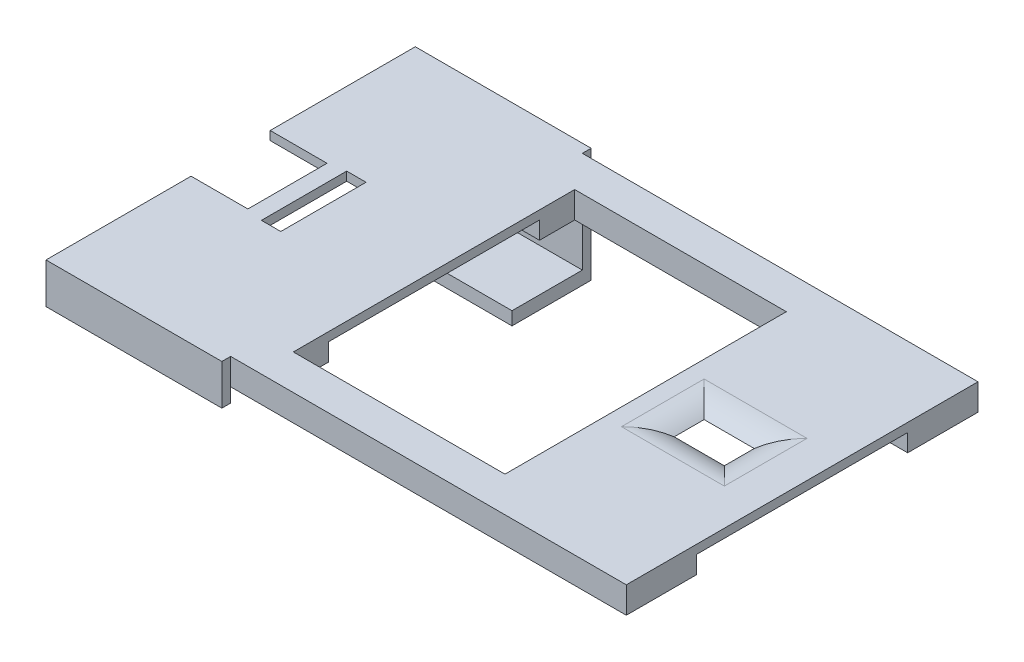
from build123d import *

# Parameters (mm, degrees)
SKETCH1_W               = 2.2
SKETCH1_H               = 9.7
SKETCH1_W_2             = 5.7
SKETCH1_H_2             = 3.4
BOSS_EXTRUDE2_DEPTH     = 3
CUT_EXTRUDE2_DEPTH      = 58.983591645
CUT_EXTRUDE2_DEPTH_BACK = 58.983591645
FILLET1_R               = 5
SKETCH4_W               = 20
SKETCH4_H               = 3
BOSS_EXTRUDE3_DEPTH     = 1
SKETCH5_W               = 20
SKETCH5_H               = 1
BOSS_EXTRUDE4_DEPTH     = 10
SKETCH6_W               = 20
SKETCH6_H               = 1.5
BOSS_EXTRUDE5_DEPTH     = 8
SKETCH7_W               = 20
SKETCH7_H               = 3
BOSS_EXTRUDE6_DEPTH     = 1
SKETCH8_W               = 20
SKETCH8_H               = 1
BOSS_EXTRUDE7_DEPTH     = 1.6


with BuildPart() as part:
    # Sketch1 → Boss-Extrude2 (new body)
    with BuildSketch(Plane(origin=(0, 0, 0), x_dir=(1, 0, 0), z_dir=(0, 1, 0))):
        Polygon((0, 15.5), (0, 0), (65, 0), (65, 40), (0, 40), (0, 24.5), (6.46, 24.5), (6.46, 15.5), align=None)
        with Locations((9.45, 20)):
            Rectangle(SKETCH1_W, SKETCH1_H, mode=Mode.SUBTRACT)
        with Locations((55, 20)):
            Rectangle(SKETCH1_W_2, SKETCH1_H_2, mode=Mode.SUBTRACT)
        Polygon((23.13, 11), (23.13, 29), (23.13, 36), (47.2, 36), (47.2, 29), (47.2, 11), (47.2, 4), (23.13, 4), align=None, mode=Mode.SUBTRACT)
    extrude(amount=BOSS_EXTRUDE2_DEPTH)

    # Sketch3 → Cut-Extrude2 (cut, two sides: drawn at the far end of the back side and taken through both)
    with BuildSketch(Plane(origin=(23.13, 0, 0), x_dir=(0, 0, -1), z_dir=(1, 0, 0)).offset(-CUT_EXTRUDE2_DEPTH_BACK)):
        Polygon((11, -0.008080614), (8, 0), (8, 2), (32, 2), (32, 0), align=None)
    extrude(amount=CUT_EXTRUDE2_DEPTH + CUT_EXTRUDE2_DEPTH_BACK, mode=Mode.SUBTRACT)

    # Fillet1
    # the kernel refuses this fillet: 5 mm, written as the material it takes off along each edge
    with BuildSketch(Plane(origin=(57.85, 3, -18.3), x_dir=(0, 0, 1), z_dir=(-1, 0, 0)), Plane(origin=(52.15, 3, -21.7), x_dir=(0, 0, -1), z_dir=(1, 0, 0))) as fillet1_piece_1:
        with BuildLine():
            CenterArc((3, -5), FILLET1_R, 90, 36.869897646)
            Line((0, -1), (0, 0))
            Line((0, 0), (3, 0))
        make_face()
    extrude(amount=5.7, mode=Mode.SUBTRACT)
    with BuildSketch(Plane(origin=(57.85, 3, -21.7), x_dir=(1, 0, 0), z_dir=(0, 0, 1)), Plane(origin=(52.15, 3, -18.3), x_dir=(-1, 0, 0), z_dir=(0, 0, -1))) as fillet1_piece_2:
        with BuildLine():
            CenterArc((3, -5), FILLET1_R, 90, 36.869897646)
            Line((0, -1), (0, 0))
            Line((0, 0), (3, 0))
        make_face()
    extrude(amount=3.4, mode=Mode.SUBTRACT)
    with BuildSketch(Plane(origin=(65.35, 3, -18.3), x_dir=(0, 0, 1), z_dir=(-1, 0, 0))) as fillet1_piece_3a_section:
        with BuildLine():
            CenterArc((3, -5), FILLET1_R, 90, 36.869897646)
            Line((0, -1), (0, 0))
            Line((0, 0), (3, 0))
        make_face()
    fillet1_piece_3a = extrude(amount=13.2, mode=Mode.PRIVATE)
    fillet1_piece_3a = split(fillet1_piece_3a, bisect_by=Plane(origin=(65, 3, -18.3), z_dir=(-1, 0, 0)), keep=Keep.TOP, mode=Mode.PRIVATE)
    fillet1_piece_3a = split(fillet1_piece_3a, bisect_by=Plane(origin=(57.85, 3, -18.3), z_dir=(1, 0, 0)), keep=Keep.TOP, mode=Mode.PRIVATE)
    with BuildSketch(Plane(origin=(57.85, 3, -21.7), x_dir=(1, 0, 0), z_dir=(0, 0, 1))) as fillet1_piece_3b_section:
        with BuildLine():
            CenterArc((3, -5), FILLET1_R, 90, 36.869897646)
            Line((0, -1), (0, 0))
            Line((0, 0), (3, 0))
        make_face()
    fillet1_piece_3b = extrude(amount=10.9, mode=Mode.PRIVATE)
    fillet1_piece_3b = split(fillet1_piece_3b, bisect_by=Plane(origin=(57.85, 3, -18.3), z_dir=(0, 0, 1)), keep=Keep.TOP, mode=Mode.PRIVATE)
    fillet1_piece_3 = fillet1_piece_3a & fillet1_piece_3b
    add(fillet1_piece_3, mode=Mode.SUBTRACT)
    with BuildSketch(Plane(origin=(57.85, 3, -18.3), x_dir=(0, 0, 1), z_dir=(-1, 0, 0))) as fillet1_piece_4a_section:
        with BuildLine():
            CenterArc((3, -5), FILLET1_R, 90, 36.869897646)
            Line((0, -1), (0, 0))
            Line((0, 0), (3, 0))
        make_face()
    fillet1_piece_4a = extrude(amount=13.2, mode=Mode.PRIVATE)
    fillet1_piece_4a = split(fillet1_piece_4a, bisect_by=Plane(origin=(47.2, 3, -18.3), z_dir=(1, 0, 0)), keep=Keep.TOP, mode=Mode.PRIVATE)
    fillet1_piece_4a = split(fillet1_piece_4a, bisect_by=Plane(origin=(52.15, 3, -18.3), z_dir=(-1, 0, 0)), keep=Keep.TOP, mode=Mode.PRIVATE)
    with BuildSketch(Plane(origin=(52.15, 3, -10.8), x_dir=(-1, 0, 0), z_dir=(0, 0, -1))) as fillet1_piece_4b_section:
        with BuildLine():
            CenterArc((3, -5), FILLET1_R, 90, 36.869897646)
            Line((0, -1), (0, 0))
            Line((0, 0), (3, 0))
        make_face()
    fillet1_piece_4b = extrude(amount=10.9, mode=Mode.PRIVATE)
    fillet1_piece_4b = split(fillet1_piece_4b, bisect_by=Plane(origin=(52.15, 3, -18.3), z_dir=(0, 0, 1)), keep=Keep.TOP, mode=Mode.PRIVATE)
    fillet1_piece_4 = fillet1_piece_4a & fillet1_piece_4b
    add(fillet1_piece_4, mode=Mode.SUBTRACT)
    with BuildSketch(Plane(origin=(52.15, 3, -21.7), x_dir=(0, 0, -1), z_dir=(1, 0, 0))) as fillet1_piece_5a_section:
        with BuildLine():
            CenterArc((3, -5), FILLET1_R, 90, 36.869897646)
            Line((0, -1), (0, 0))
            Line((0, 0), (3, 0))
        make_face()
    fillet1_piece_5a = extrude(amount=13.2, mode=Mode.PRIVATE)
    fillet1_piece_5a = split(fillet1_piece_5a, bisect_by=Plane(origin=(65, 3, -21.7), z_dir=(-1, 0, 0)), keep=Keep.TOP, mode=Mode.PRIVATE)
    fillet1_piece_5a = split(fillet1_piece_5a, bisect_by=Plane(origin=(57.85, 3, -21.7), z_dir=(1, 0, 0)), keep=Keep.TOP, mode=Mode.PRIVATE)
    with BuildSketch(Plane(origin=(57.85, 3, -29.2), x_dir=(1, 0, 0), z_dir=(0, 0, 1))) as fillet1_piece_5b_section:
        with BuildLine():
            CenterArc((3, -5), FILLET1_R, 90, 36.869897646)
            Line((0, -1), (0, 0))
            Line((0, 0), (3, 0))
        make_face()
    fillet1_piece_5b = extrude(amount=10.9, mode=Mode.PRIVATE)
    fillet1_piece_5b = split(fillet1_piece_5b, bisect_by=Plane(origin=(57.85, 3, -21.7), z_dir=(0, 0, -1)), keep=Keep.TOP, mode=Mode.PRIVATE)
    fillet1_piece_5 = fillet1_piece_5a & fillet1_piece_5b
    add(fillet1_piece_5, mode=Mode.SUBTRACT)
    with BuildSketch(Plane(origin=(52.15, 3, -18.3), x_dir=(-1, 0, 0), z_dir=(0, 0, -1))) as fillet1_piece_6a_section:
        with BuildLine():
            CenterArc((3, -5), FILLET1_R, 90, 36.869897646)
            Line((0, -1), (0, 0))
            Line((0, 0), (3, 0))
        make_face()
    fillet1_piece_6a = extrude(amount=10.9, mode=Mode.PRIVATE)
    fillet1_piece_6a = split(fillet1_piece_6a, bisect_by=Plane(origin=(52.15, 3, -21.7), z_dir=(0, 0, -1)), keep=Keep.TOP, mode=Mode.PRIVATE)
    with BuildSketch(Plane(origin=(44.65, 3, -21.7), x_dir=(0, 0, -1), z_dir=(1, 0, 0))) as fillet1_piece_6b_section:
        with BuildLine():
            CenterArc((3, -5), FILLET1_R, 90, 36.869897646)
            Line((0, -1), (0, 0))
            Line((0, 0), (3, 0))
        make_face()
    fillet1_piece_6b = extrude(amount=13.2, mode=Mode.PRIVATE)
    fillet1_piece_6b = split(fillet1_piece_6b, bisect_by=Plane(origin=(47.2, 3, -21.7), z_dir=(1, 0, 0)), keep=Keep.TOP, mode=Mode.PRIVATE)
    fillet1_piece_6b = split(fillet1_piece_6b, bisect_by=Plane(origin=(52.15, 3, -21.7), z_dir=(-1, 0, 0)), keep=Keep.TOP, mode=Mode.PRIVATE)
    fillet1_piece_6 = fillet1_piece_6a & fillet1_piece_6b
    add(fillet1_piece_6, mode=Mode.SUBTRACT)

    # Sketch4 → Boss-Extrude3 (add)
    with BuildSketch(Plane(origin=(0, 0, -40), x_dir=(-1, 0, 0), z_dir=(0, 0, -1))):
        with Locations((-10, 1.5)):
            Rectangle(SKETCH4_W, SKETCH4_H)
    extrude(amount=BOSS_EXTRUDE3_DEPTH)

    # Sketch5 → Boss-Extrude4 (add)
    with BuildSketch(Plane.XZ):
        with Locations((10, -40.5)):
            Rectangle(SKETCH5_W, SKETCH5_H)
    extrude(amount=BOSS_EXTRUDE4_DEPTH)

    # Sketch6 → Boss-Extrude5 (add)
    with BuildSketch(Plane.XY.offset(-40)):
        with Locations((10, -9.25)):
            Rectangle(SKETCH6_W, SKETCH6_H)
    extrude(amount=BOSS_EXTRUDE5_DEPTH)

    # Sketch7 → Boss-Extrude6 (add)
    with BuildSketch(Plane.XY):
        with Locations((10, 1.5)):
            Rectangle(SKETCH7_W, SKETCH7_H)
    extrude(amount=BOSS_EXTRUDE6_DEPTH)

    # Sketch8 → Boss-Extrude7 (add)
    with BuildSketch(Plane.XZ):
        with Locations((10, 0.5)):
            Rectangle(SKETCH8_W, SKETCH8_H)
    extrude(amount=BOSS_EXTRUDE7_DEPTH)


solid = part.part
